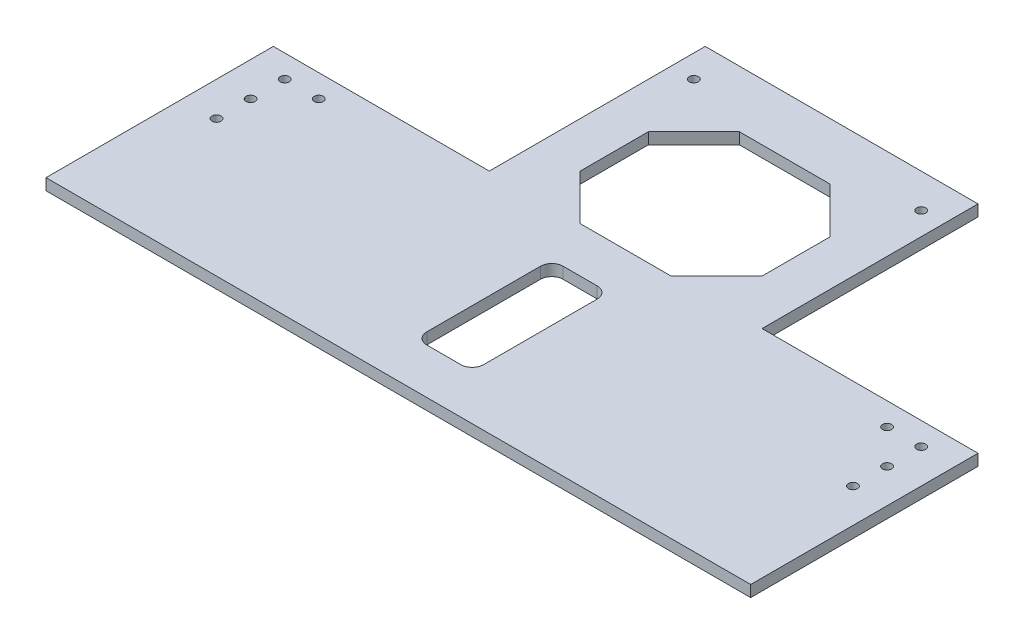
from build123d import *

# Parameters (mm, degrees)
BOSS_EXTRUDE1_DEPTH = 5
SKETCH2_R           = 2
SKETCH2_W           = 25
SKETCH2_H           = 60
CUT_EXTRUDE1_DEPTH  = 213.308737456
FILLET1_R           = 5
SKETCH5_W           = 80
SKETCH5_H           = 70
CUT_EXTRUDE2_DEPTH  = 5
CHAMFER1_SIZE       = 20


with BuildPart() as part:
    # Sketch1 → Boss-Extrude1 (new body)
    with BuildSketch(Plane(origin=(0, 0, 0), x_dir=(1, 0, 0), z_dir=(0, 1, 0))):
        Polygon((-60, 50), (-155, 50), (-155, -50), (155, -50), (155, 50), (60, 50), (60, 145), (-60, 145), align=None)
    extrude(amount=BOSS_EXTRUDE1_DEPTH)

    # Sketch2 → Cut-Extrude1 (cut, through all)
    with BuildSketch(Plane(origin=(0, 5, 0), x_dir=(1, 0, 0), z_dir=(0, 1, 0))):
        with Locations((-140, 40)):
            Circle(SKETCH2_R)
        with Locations((-125, 40)):
            Circle(SKETCH2_R)
        with Locations((-140, 25)):
            Circle(SKETCH2_R)
        with Locations((-140, 10)):
            Circle(SKETCH2_R)
        with Locations((140, 10)):
            Circle(SKETCH2_R)
        with Locations((140, 25)):
            Circle(SKETCH2_R)
        with Locations((125, 40)):
            Circle(SKETCH2_R)
        with Locations((140, 40)):
            Circle(SKETCH2_R)
        with Locations((-50, 130)):
            Circle(SKETCH2_R)
        with Locations((50, 130)):
            Circle(SKETCH2_R)
        Rectangle(SKETCH2_W, SKETCH2_H)
    extrude(amount=-CUT_EXTRUDE1_DEPTH, mode=Mode.SUBTRACT)

    # Fillet1
    fillet1_edges = [part.edges().sort_by_distance(p)[0] for p in [
        (-12.5, 2.5, 30),
        (12.5, 2.5, -30),
        (12.5, 2.5, 30),
        (-12.5, 2.5, -30),
    ]]
    fillet(fillet1_edges, radius=FILLET1_R)

    # Sketch5 → Cut-Extrude2 (cut)
    with BuildSketch(Plane(origin=(0, 5, 0), x_dir=(1, 0, 0), z_dir=(0, 1, 0))):
        with Locations((0, 85)):
            Rectangle(SKETCH5_W, SKETCH5_H)
    extrude(amount=-CUT_EXTRUDE2_DEPTH, mode=Mode.SUBTRACT)

    # Chamfer1
    chamfer1_edges = [part.edges().sort_by_distance(p)[0] for p in [
        (-40, 2.5, -50),
        (40, 2.5, -50),
        (40, 2.5, -120),
        (-40, 2.5, -120),
    ]]
    chamfer(chamfer1_edges, length=CHAMFER1_SIZE)


solid = part.part
